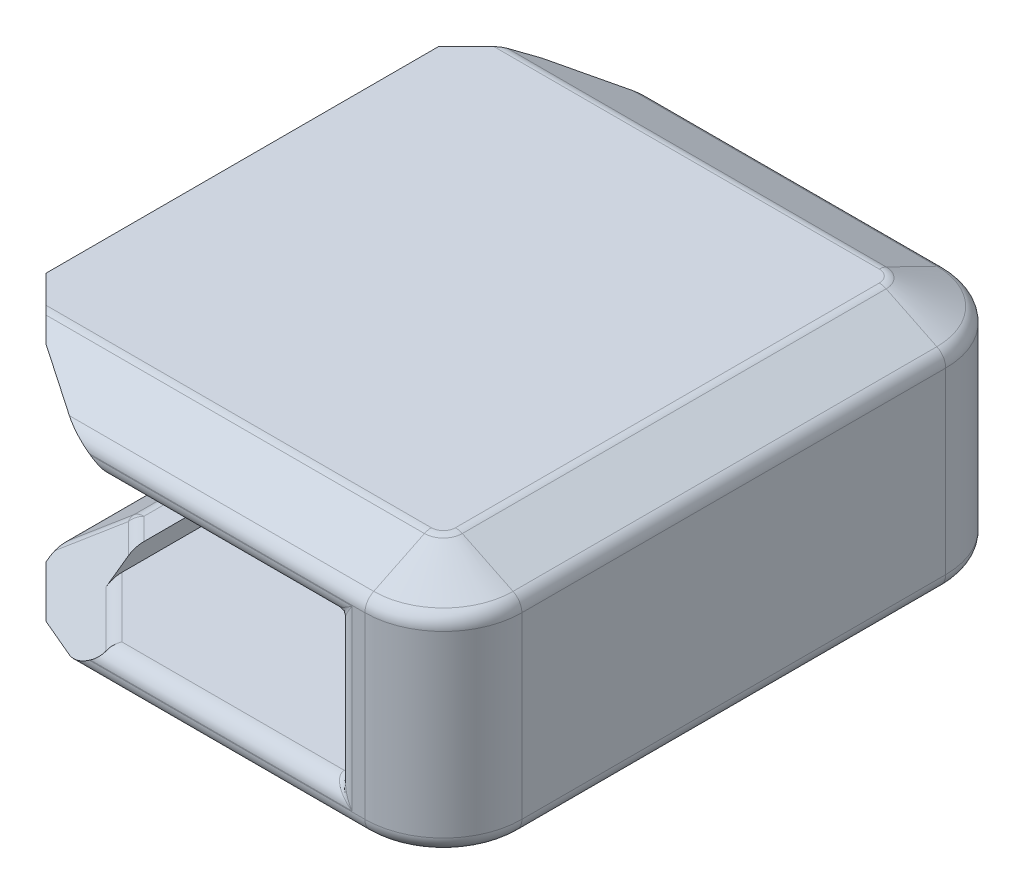
from build123d import *
from OCP.BRepFilletAPI import BRepFilletAPI_MakeChamfer

# Parameters (mm, degrees)
BOSS_EXTRUDE1_DEPTH = 14.8
CHAMFER1_SIZE       = 2.4
CHAMFER2_SIZE       = 1.6
FILLET2_R           = 2
CHAMFER3_SIZE       = 1.6
CHAMFER3_SIZE2      = 0.780372142
FILLET3_R           = 0.4
FILLET4_R           = 0.4
FILLET5_R           = 0.2


# Some blends are built 0.0001 mm under size
with BuildPart() as part:
    # Sketch1 → Boss-Extrude1 (new body)
    with BuildSketch(Plane.XY):
        Polygon((0, -1.86), (0, 1.86), (-7.4, 1.86), (-7.4, 1.46), (-8.1, 1.46), (-9.8, 2.850554342), (-9.8, 3.31), (2.72661591, 3.31), (2.72661591, -3.31), (-9.8, -3.31), (-9.8, -2.850554342), (-8.1, -1.46), (-7.4, -1.46), (-7.4, -1.86), align=None)
    extrude(amount=BOSS_EXTRUDE1_DEPTH)

    # Chamfer1
    chamfer1_edges = [part.edges().sort_by_distance(p)[0] for p in [
        (-9.8, 3.080277171, 0),
        (-9.8, -3.080277171, 0),
        (-9.8, -3.080277171, 14.8),
        (-9.8, 3.080277171, 14.8),
    ]]
    chamfer(chamfer1_edges, length=CHAMFER1_SIZE - 0.0001)  # a hair under: the kernel refuses the full size

    # Chamfer2
    # the kernel refuses this chamfer: 1.6 mm, written as the material it takes off along each edge
    with BuildSketch(Plane(origin=(-11.009527168, 1.46, 11.190572832), x_dir=(0.7068394360706733, -0.027495876610586303, -0.7068394360706736), z_dir=(0.7071067811865477, 0, 0.7071067811865474))) as chamfer2_piece_1:
        Polygon((CHAMFER2_SIZE * 0.999621916911, CHAMFER2_SIZE * 0.0274958766106), (-CHAMFER2_SIZE * 0.0274958766106, CHAMFER2_SIZE * 0.999621916911), (0, 0), align=None)
    extrude(amount=9.219193634, mode=Mode.SUBTRACT)
    with BuildSketch(Plane(origin=(-11.009527168, -1.46, 11.190572832), x_dir=(0.7068394360706733, 0.027495876610586556, -0.7068394360706737), z_dir=(0.7071067811865477, 0, 0.7071067811865474)), Plane(origin=(-11.009527168, 1.46, 3.609427168), x_dir=(0.7068394360706735, -0.027495876610586275, 0.7068394360706735), z_dir=(0.7071067811865476, 0, -0.7071067811865476)), Plane(origin=(-11.009527168, -1.46, 3.609427168), x_dir=(-0.01944252080601407, -0.9996219169112966, -0.01944252080601438), z_dir=(0.7071067811865476, 0, -0.7071067811865476))) as chamfer2_piece_2:
        Polygon((CHAMFER2_SIZE * 0.999621916911, -CHAMFER2_SIZE * 0.0274958766106), (-CHAMFER2_SIZE * 0.0274958766106, -CHAMFER2_SIZE * 0.999621916911), (0, 0), align=None)
    extrude(amount=9.219193634, mode=Mode.SUBTRACT)

    # Fillet2
    fillet2_edges = [part.edges().sort_by_distance(p)[0] for p in [
        (2.72661591, 0, 0),
        (2.72661591, 0, 14.8),
    ]]
    fillet(fillet2_edges, radius=FILLET2_R)

    # Chamfer3: one chamfer whose edges measure the first distance from different faces: ONE call of the kernel's chamfer builder (chamfer() names one face for all edges)
    chamfer3_edges_1 = [part.edges().sort_by_distance(p)[0] for p in [
        (-3.336742045, 3.31, 0),
        (2.140829472, 3.31, 0.585786438),
        (2.72661591, 3.31, 7.4),
        (2.140829472, 3.31, 14.214213562),
        (-3.336742045, 3.31, 14.8),
    ]]
    chamfer3_side_1 = [part.faces().sort_by_distance(p)[0] for p in [
        (-3.415960598, 3.31, 7.4),
    ]]
    chamfer3_edges_2 = [part.edges().sort_by_distance(p)[0] for p in [
        (-3.336742045, -3.31, 0),
        (2.140829472, -3.31, 0.585786438),
        (2.72661591, -3.31, 7.4),
        (2.140829472, -3.31, 14.214213562),
        (-3.336742045, -3.31, 14.8),
    ]]
    chamfer3_side_2 = [part.faces().sort_by_distance(p)[0] for p in [
        (-3.415960598, -3.31, 7.4),
    ]]
    chamfer3 = BRepFilletAPI_MakeChamfer(part.part.solid().wrapped)
    for e in chamfer3_edges_1:
        chamfer3.Add(CHAMFER3_SIZE, CHAMFER3_SIZE2, e.wrapped, chamfer3_side_1[0].wrapped)  # the first distance lies on this face
    for e in chamfer3_edges_2:
        chamfer3.Add(CHAMFER3_SIZE, CHAMFER3_SIZE2, e.wrapped, chamfer3_side_2[0].wrapped)  # the first distance lies on this face
    add(Compound.cast(chamfer3.Shape()), mode=Mode.REPLACE)

    # Fillet3
    fillet3_edges = [part.edges().sort_by_distance(p)[0] for p in [
        (-2.961712307, 2.529627858, 0),
        (-2.961712307, -2.529627858, 0),
        (2.140829472, 2.529627858, 0.585786438),
        (2.140829472, -2.529627858, 0.585786438),
        (2.72661591, 2.529627858, 7.4),
        (2.72661591, -2.529627858, 7.4),
        (2.140829472, 2.529627858, 14.214213562),
        (2.140829472, -2.529627858, 14.214213562),
        (-2.961712307, 2.529627858, 14.8),
        (-2.961712307, -2.529627858, 14.8),
        (-2.851521863, -1.86, 0),
        (0, 0, 0),
        (0, 0, 14.8),
        (-2.851521863, -1.86, 14.8),
        (-8.1, 1.46, 7.4),
        (-7.75, 1.46, 12.1873583),
        (-7.75, 1.46, 2.6126417),
        (-2.851521863, 1.86, 0),
        (-2.851521863, 1.86, 14.8),
        (-6.551521863, 1.86, 13.951521863),
        (-6.551521863, 1.86, 0.848478137),
        (-9.8, 2.850554342, 7.4),
        (-8.95, 2.155277171, 11.970628705),
        (-8.95, 2.155277171, 2.829371295),
        (-8.1, -1.46, 7.4),
        (-7.75, -1.46, 12.1873583),
        (-7.75, -1.46, 2.6126417),
        (-9.8, -2.850554342, 7.4),
        (-8.95, -2.155277171, 11.970628705),
        (-8.95, -2.155277171, 2.829371295),
        (-6.551521863, -1.86, 13.951521863),
        (-6.551521863, -1.86, 0.848478137),
    ]]
    fillet(fillet3_edges, radius=FILLET3_R)

    # Fillet4
    fillet4_edges = [part.edges().sort_by_distance(p)[0] for p in [
        (-4.136742045, -3.31, 13.2),
        (1.009458622, -3.31, 13.082842712),
        (1.12661591, -3.31, 7.4),
        (1.009458622, -3.31, 1.717157288),
        (-4.136742045, -3.31, 1.6),
        (-4.136742045, 3.31, 13.2),
        (1.009458622, 3.31, 13.082842712),
        (1.12661591, 3.31, 7.4),
        (1.009458622, 3.31, 1.717157288),
        (-4.136742045, 3.31, 1.6),
    ]]
    fillet(fillet4_edges, radius=FILLET4_R)

    # Fillet5
    fillet5_edges = [part.edges().sort_by_distance(p)[0] for p in [
        (0, -1.86, 7.4),
        (0, 1.86, 7.4),
        (0.141580437, 2.001580437, 14.705318407),
        (0.141580437, -2.001580437, 14.705318407),
        (0.141580437, 2.001580437, 0.094681593),
        (0.141580437, -2.001580437, 0.094681593),
    ]]
    fillet(fillet5_edges, radius=FILLET5_R)


solid = part.part
